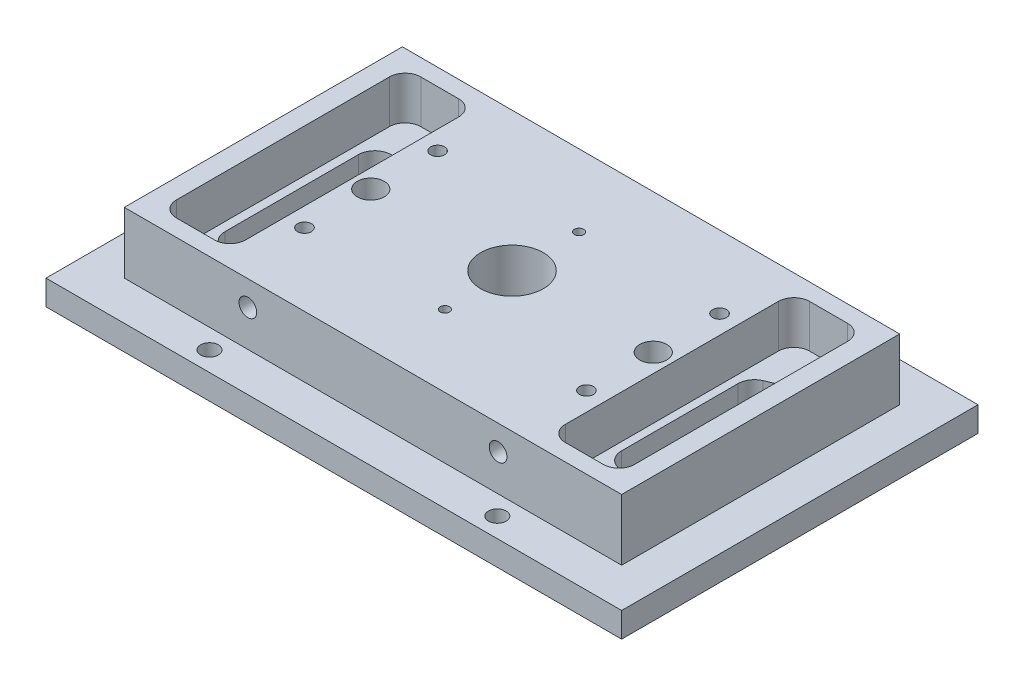
from build123d import *

# Parameters (mm, degrees)
MAIN_SKETCH_W                         = 73.5
MAIN_SKETCH_H                         = 45.5
MAIN_SKETCH_W_2                       = 63.5
MAIN_SKETCH_H_2                       = 35.5
LIP_DEPTH                             = 3.175
MOUNTING_BASE_OUTLINE_W               = 63.5
MOUNTING_BASE_OUTLINE_H               = 35.5
MOUNTING_BASE_OUTLINE_R               = 1.7272
MOUNTING_BASE_OUTLINE_R_2             = 4
MOUNTING_BASE_DEPTH                   = 11
HEATER_CART_4_40_TAPS_D               = 2.2606
HEATER_CART_4_40_TAPS_DEPTH           = 7.595
HEATER_CART_4_40_TAPS_TIP             = 0.679152758
HEATER_CART_4_40_TAPS_ON_FACE_2_D     = 2.2606
HEATER_CART_4_40_TAPS_ON_FACE_2_DEPTH = 7.595
HEATER_CART_4_40_TAPS_ON_FACE_2_TIP   = 0.679152758
MAIN_SKETCH_12_W                      = 8.85
MAIN_SKETCH_12_H                      = 31.2
BOTTOM_SQUARE_CUTOUT_DEPTH            = 2
SQUARE_MICRO_D_CUTOUT_START           = 5.5
SQUARE_MICRO_D_CUTOUT_OUTLINE_W       = 8.85
SQUARE_MICRO_D_CUTOUT_OUTLINE_H       = 31.2
SQUARE_MICRO_D_CUTOUT_DEPTH           = 5.5
MAIN_SKETCH_7_R                       = 0.285
ROUND_MICRO_D_CUTOUT_DEPTH            = 11
INTERNAL_CORNER_CUTOUTS_FILLET_R      = 2
CHIP_CLAMP_0_80_TAPS_AT_2_COUNT       = 2
CHIP_CLAMP_0_80_TAPS_AT_2_PITCH       = 17.1232
CHIP_CLAMP_0_80_TAPS_AT_3_COUNT       = 2
CHIP_CLAMP_0_80_TAPS_AT_3_PITCH       = 17.1232
F_2_56_CLOSE_CLEAR_43_0_089_D         = 2.2606
PCB_2_56_TAPS_D                       = 1.778
PCB_2_56_TAPS_DEPTH                   = 5.734
PCB_2_56_TAPS_TIP                     = 0.53416509
BOTTOM_COVER_2_56_TAPS_D              = 1.778
BOTTOM_COVER_2_56_TAPS_DEPTH          = 5.734
BOTTOM_COVER_2_56_TAPS_TIP            = 0.53416509
F_2_56_TAPPED_HOLE1_D                 = 1.778
F_2_56_TAPPED_HOLE1_DEPTH             = 5.734
F_2_56_TAPPED_HOLE1_TIP               = 0.53416509


# Read off the part's stored shape, not the designer's step: Mounting_Base, Square_Micro_D_Cutout
with BuildPart() as part:
    # Main_Sketch → Lip (new body)
    with BuildSketch(Plane(origin=(0, 0, 0), x_dir=(1, 0, 0), z_dir=(0, 1, 0))):
        with Locations((36.75, -22.75)):
            Rectangle(MAIN_SKETCH_W, MAIN_SKETCH_H)
        with Locations((36.75, -22.75)):
            Rectangle(MAIN_SKETCH_W_2, MAIN_SKETCH_H_2, mode=Mode.SUBTRACT)
    extrude(amount=LIP_DEPTH)

    # Mounting_Base outline → Mounting_Base (add)
    with BuildSketch(Plane(origin=(0, 0, 0), x_dir=(1, 0, 0), z_dir=(0, 1, 0))):
        with Locations((36.75, -22.75)):
            Rectangle(MOUNTING_BASE_OUTLINE_W, MOUNTING_BASE_OUTLINE_H)
        with Locations((18.716, -22.75)):
            Circle(MOUNTING_BASE_OUTLINE_R, mode=Mode.SUBTRACT)
        with Locations((36.75, -22.75)):
            Circle(MOUNTING_BASE_OUTLINE_R_2, mode=Mode.SUBTRACT)
        with Locations((54.784, -22.75)):
            Circle(MOUNTING_BASE_OUTLINE_R, mode=Mode.SUBTRACT)
    extrude(amount=MOUNTING_BASE_DEPTH)

    # Heater_Cart_#4-40_Taps
    with Locations(Plane(origin=(52.725, 7.825, 5), x_dir=(-1, 0, 0), z_dir=(0, 0, -1))):
        with Locations((0, 0), (31.95, 0)):
            Hole(HEATER_CART_4_40_TAPS_D / 2, depth=HEATER_CART_4_40_TAPS_DEPTH)
            with Locations((0, 0, -(HEATER_CART_4_40_TAPS_DEPTH + HEATER_CART_4_40_TAPS_TIP / 2))):  # 118° drill point
                Cone(0, HEATER_CART_4_40_TAPS_D / 2, HEATER_CART_4_40_TAPS_TIP, mode=Mode.SUBTRACT)

    # Heater_Cart_#4-40_Taps on face 2
    with Locations(Plane(origin=(20.775, 7.825, 40.5), x_dir=(1, 0, 0), z_dir=(0, 0, 1))):
        with Locations((0, 0), (31.95, 0)):
            Hole(HEATER_CART_4_40_TAPS_ON_FACE_2_D / 2, depth=HEATER_CART_4_40_TAPS_ON_FACE_2_DEPTH)
            with Locations((0, 0, -(HEATER_CART_4_40_TAPS_ON_FACE_2_DEPTH + HEATER_CART_4_40_TAPS_ON_FACE_2_TIP / 2))):  # 118° drill point
                Cone(0, HEATER_CART_4_40_TAPS_ON_FACE_2_D / 2, HEATER_CART_4_40_TAPS_ON_FACE_2_TIP, mode=Mode.SUBTRACT)

    # Main_Sketch<12> → Bottom_square_cutout (cut)
    with BuildSketch(Plane(origin=(0, 0, 0), x_dir=(1, 0, 0), z_dir=(0, 1, 0))):
        with Locations((11.925, -22.75)):
            Rectangle(MAIN_SKETCH_12_W, MAIN_SKETCH_12_H)
        with BuildLine():
            ThreePointArc((11.521574965, -33.196222286), (10.496212222, -33.351578951), (9.521946869, -32.996175702))
            ThreePointArc((9.521946869, -32.996175702), (8.851632057, -32.244424217), (8.609546604, -31.26675))
            Line((8.609546604, -31.26675), (8.609546604, -14.23325))
            ThreePointArc((8.609546604, -14.23325), (8.851632057, -13.255575783), (9.521946869, -12.503824298))
            ThreePointArc((9.521946869, -12.503824298), (10.496212222, -12.148421049), (11.521574965, -12.303777714))
            Line((11.521574965, -12.303777714), (14.054010046, -13.37581902))
            ThreePointArc((14.054010046, -13.37581902), (14.983840891, -14.148001292), (15.3324534, -15.305291306))
            Line((15.3324534, -15.305291306), (15.3324534, -30.194708694))
            ThreePointArc((15.3324534, -30.194708694), (14.983840891, -31.351998708), (14.054010046, -32.12418098))
            Line((14.054010046, -32.12418098), (11.521574965, -33.196222286))
        make_face(mode=Mode.SUBTRACT)
    bottom_square_cutout = extrude(amount=BOTTOM_SQUARE_CUTOUT_DEPTH, mode=Mode.SUBTRACT)

    # Square_Micro_D_Cutout outline → Square_Micro_D_Cutout (cut)
    with BuildSketch(Plane(origin=(0, 0, 0), x_dir=(1, 0, 0), z_dir=(0, 1, 0)).offset(SQUARE_MICRO_D_CUTOUT_START)):
        with Locations((11.925, -22.75)):
            Rectangle(SQUARE_MICRO_D_CUTOUT_OUTLINE_W, SQUARE_MICRO_D_CUTOUT_OUTLINE_H)
        with BuildLine():
            ThreePointArc((11.521574965, -33.196222286), (9.547492447, -33.013373348), (8.609546604, -31.26675))
            Line((8.609546604, -31.26675), (8.609546604, -14.23325))
            ThreePointArc((8.609546604, -14.23325), (9.547492447, -12.486626652), (11.521574965, -12.303777714))
            Line((11.521574965, -12.303777714), (14.054010046, -13.37581902))
            ThreePointArc((14.054010046, -13.37581902), (14.983840891, -14.148001291), (15.3324534, -15.305291306))
            Line((15.3324534, -15.305291306), (15.3324534, -30.194708694))
            ThreePointArc((15.3324534, -30.194708694), (14.983840891, -31.351998709), (14.054010046, -32.12418098))
            Line((14.054010046, -32.12418098), (11.521574965, -33.196222286))
        make_face(mode=Mode.SUBTRACT)
    square_micro_d_cutout = extrude(amount=SQUARE_MICRO_D_CUTOUT_DEPTH, mode=Mode.SUBTRACT)

    # Main_Sketch<7> → Round_Micro_D_Cutout (cut)
    # profile 1 of 2: a face of its own
    with BuildSketch(Plane(origin=(0, 0, 0), x_dir=(1, 0, 0), z_dir=(0, 1, 0))):
        with BuildLine():
            ThreePointArc((9.521946869, -32.996175702), (8.851632057, -32.244424217), (8.609546604, -31.26675))
            Line((8.609546604, -31.26675), (8.609546604, -14.23325))
            ThreePointArc((8.609546604, -14.23325), (8.851632057, -13.255575783), (9.521946869, -12.503824298))
            ThreePointArc((9.521946869, -12.503824298), (10.496212222, -12.148421049), (11.521574965, -12.303777714))
            Line((11.521574965, -12.303777714), (14.054010046, -13.37581902))
            ThreePointArc((14.054010046, -13.37581902), (14.983840891, -14.148001292), (15.3324534, -15.305291306))
            Line((15.3324534, -15.305291306), (15.3324534, -30.194708694))
            ThreePointArc((15.3324534, -30.194708694), (14.983840891, -31.351998708), (14.054010046, -32.12418098))
            Line((14.054010046, -32.12418098), (11.521574965, -33.196222286))
            ThreePointArc((11.521574965, -33.196222286), (10.496212222, -33.351578951), (9.521946869, -32.996175702))
        make_face()
        with Locations((11.399546604, -22.75)):
            Circle(MAIN_SKETCH_7_R, mode=Mode.SUBTRACT)
    # profile 2 of 2: a face of its own
    with BuildSketch(Plane(origin=(0, 0, 0), x_dir=(1, 0, 0), z_dir=(0, 1, 0))):
        with Locations((11.399546604, -22.75)):
            Circle(MAIN_SKETCH_7_R)
    round_micro_d_cutout = extrude(amount=ROUND_MICRO_D_CUTOUT_DEPTH, mode=Mode.SUBTRACT)

    # MicroD_Mirror: Bottom_square_cutout, Square_Micro_D_Cutout, Round_Micro_D_Cutout across plane
    add(bottom_square_cutout.mirror(Plane(origin=(36.75, 0, 0), x_dir=(0, 0, 1), z_dir=(1, 0, 0))), mode=Mode.SUBTRACT)
    add(square_micro_d_cutout.mirror(Plane(origin=(36.75, 0, 0), x_dir=(0, 0, 1), z_dir=(1, 0, 0))), mode=Mode.SUBTRACT)
    add(round_micro_d_cutout.mirror(Plane(origin=(36.75, 0, 0), x_dir=(0, 0, 1), z_dir=(1, 0, 0))), mode=Mode.SUBTRACT)

    # Internal_Corner_cutouts_fillet
    internal_corner_cutouts_fillet_edges = [part.edges().sort_by_distance(p)[0] for p in [
        (16.35, 8.25, 38.35),
        (7.5, 8.25, 38.35),
        (7.5, 8.25, 7.15),
        (16.35, 8.25, 7.15),
        (57.15, 1, 7.15),
        (57.15, 1, 38.35),
        (66, 1, 38.35),
        (66, 1, 7.15),
        (66, 8.25, 7.15),
        (66, 8.25, 38.35),
        (57.15, 8.25, 38.35),
        (57.15, 8.25, 7.15),
        (16.35, 1, 38.35),
        (16.35, 1, 7.15),
        (7.5, 1, 7.15),
        (7.5, 1, 38.35),
    ]]
    fillet(internal_corner_cutouts_fillet_edges, radius=INTERNAL_CORNER_CUTOUTS_FILLET_R)

    # Sketch3 → Chip_Clamp_#0-80 Taps (revolve, cut)
    with BuildSketch(Plane(origin=(36.75, 11, 31.3116), x_dir=(0, 0, 1), z_dir=(1, 0, 0))):
        Polygon((0, 0), (0, 4.358890611), (0.59563, 4.001), (0.59563, 0), align=None)
    chip_clamp_0_80_taps = revolve(axis=Axis((36.75, 17.35, 31.3116), (0, -1, 0)), mode=Mode.SUBTRACT)

    # Chip_Clamp_#0-80 Taps at 2: Chip_Clamp_#0-80 Taps ×2
    with Locations(*[(0, 0, -i * CHIP_CLAMP_0_80_TAPS_AT_2_PITCH) for i in range(1, CHIP_CLAMP_0_80_TAPS_AT_2_COUNT)]):
        add(chip_clamp_0_80_taps, mode=Mode.SUBTRACT)

    # Chip_Clamp_#0-80 Taps at 3: Chip_Clamp_#0-80 Taps ×2
    with Locations(*[(0, 0, -i * CHIP_CLAMP_0_80_TAPS_AT_3_PITCH) for i in range(1, CHIP_CLAMP_0_80_TAPS_AT_3_COUNT)]):
        add(chip_clamp_0_80_taps, mode=Mode.SUBTRACT)

    # 2-56_Close_Clear#43 (0.089) (through all)
    with Locations(Plane(origin=(18.375, 0, 43), x_dir=(0, 0, -1), z_dir=(0, -1, 0))):
        with Locations((0, 0), (40.5, 0), (40.5, 36.75), (0, 36.75)):
            Hole(F_2_56_CLOSE_CLEAR_43_0_089_D / 2)

    # PCB #2-56 Taps
    with Locations(Plane(origin=(18.75, 11, 14.25), x_dir=(0, 0, 1), z_dir=(0, 1, 0))):
        with Locations((0, 0), (17, 0), (0, 36), (17, 36)):
            Hole(PCB_2_56_TAPS_D / 2, depth=PCB_2_56_TAPS_DEPTH)
            with Locations((0, 0, -(PCB_2_56_TAPS_DEPTH + PCB_2_56_TAPS_TIP / 2))):  # 118° drill point
                Cone(0, PCB_2_56_TAPS_D / 2, PCB_2_56_TAPS_TIP, mode=Mode.SUBTRACT)

    # Bottom_Cover#2-56 Taps
    with Locations(Plane(origin=(54.785, 0, 18.750000125), x_dir=(0, 0, -1), z_dir=(0, -1, 0))):
        with Locations((0, 0), (-8, 0), (-8, -36.07), (0, -36.07)):
            Hole(BOTTOM_COVER_2_56_TAPS_D / 2, depth=BOTTOM_COVER_2_56_TAPS_DEPTH)
            with Locations((0, 0, -(BOTTOM_COVER_2_56_TAPS_DEPTH + BOTTOM_COVER_2_56_TAPS_TIP / 2))):  # 118° drill point
                Cone(0, BOTTOM_COVER_2_56_TAPS_D / 2, BOTTOM_COVER_2_56_TAPS_TIP, mode=Mode.SUBTRACT)

    # #2-56 Tapped Hole1
    with Locations(Plane(origin=(32.94, 0, 31.38), x_dir=(0, 0, -1), z_dir=(0, -1, 0))):
        with Locations((0, 0), (-7.62, 0), (-7.62, 7.62), (0, 7.62)):
            Hole(F_2_56_TAPPED_HOLE1_D / 2, depth=F_2_56_TAPPED_HOLE1_DEPTH)
            with Locations((0, 0, -(F_2_56_TAPPED_HOLE1_DEPTH + F_2_56_TAPPED_HOLE1_TIP / 2))):  # 118° drill point
                Cone(0, F_2_56_TAPPED_HOLE1_D / 2, F_2_56_TAPPED_HOLE1_TIP, mode=Mode.SUBTRACT)


solid = part.part
